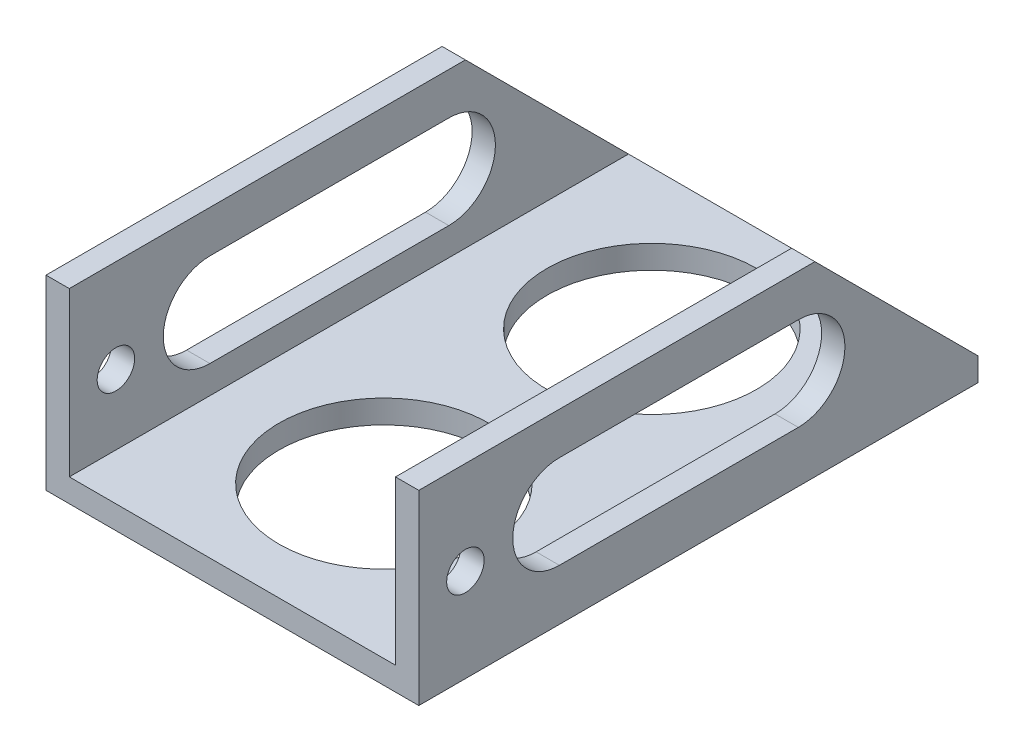
from build123d import *

# Parameters (mm, degrees)
BOSS_EXTRUDE1_DEPTH     = 76.2
CUT_EXTRUDE1_REACH      = 97.038
SKETCH2_R               = 14.2875
SKETCH3_R               = 2.5527
CUT_EXTRUDE2_DEPTH      = 96.038097624
CUT_EXTRUDE3_DEPTH      = 94.379551429
CUT_EXTRUDE3_DEPTH_BACK = 94.379551429
CUT_EXTRUDE4_REACH      = 96.239
SKETCH5_R               = 14.2875
CUT_EXTRUDE5_DEPTH      = 94.379551429
CUT_EXTRUDE5_DEPTH_BACK = 94.379551429


with BuildPart() as part:
    # Sketch1 → Boss-Extrude1 (new body)
    with BuildSketch(Plane.XY):
        Polygon((3.175, 3.175), (3.175, 25.4), (0, 25.4), (0, 0), (50.8, 0), (50.8, 25.4), (47.625, 25.4), (47.625, 3.175), align=None)
    extrude(amount=BOSS_EXTRUDE1_DEPTH)

    # Sketch2 → Cut-Extrude1 (cut, up to next)
    with BuildSketch(Plane.XZ, mode=Mode.PRIVATE) as cut_extrude1_sk1:
        with Locations((25.4, 19.05)):
            Circle(SKETCH2_R)
    cut_extrude1_tool1 = extrude(cut_extrude1_sk1.sketch, amount=-CUT_EXTRUDE1_REACH, mode=Mode.PRIVATE) & part.part
    add(cut_extrude1_tool1.solids().sort_by_distance((25.4, 0, 19.05))[0], mode=Mode.SUBTRACT)

    # Sketch3 → Cut-Extrude2 (cut, through all)
    with BuildSketch(Plane.ZY):
        with Locations((69.85, 12.7)):
            Circle(SKETCH3_R)
    extrude(amount=-CUT_EXTRUDE2_DEPTH, mode=Mode.SUBTRACT)

    # Sketch4 → Cut-Extrude3 (cut, two sides: drawn at the far end of the back side and taken through both)
    with BuildSketch(Plane.ZY.offset(-47.625).offset(-CUT_EXTRUDE3_DEPTH_BACK)):
        Polygon((0, 3.175), (22.225, 25.4), (0, 25.4), align=None)
    extrude(amount=CUT_EXTRUDE3_DEPTH + CUT_EXTRUDE3_DEPTH_BACK, mode=Mode.SUBTRACT)

    # Sketch5 → Cut-Extrude4 (cut, up to next)
    with BuildSketch(Plane(origin=(0, 3.175, 0), x_dir=(1, 0, 0), z_dir=(0, 1, 0)), mode=Mode.PRIVATE) as cut_extrude4_sk1:
        with Locations((25.4, -55.5625)):
            Circle(SKETCH5_R)
    cut_extrude4_tool1 = extrude(cut_extrude4_sk1.sketch, amount=-CUT_EXTRUDE4_REACH, mode=Mode.PRIVATE) & part.part
    add(cut_extrude4_tool1.solids().sort_by_distance((25.4, 3.175, 55.5625))[0], mode=Mode.SUBTRACT)

    # Sketch6 → Cut-Extrude5 (cut, two sides: drawn at the far end of the back side and taken through both)
    with BuildSketch(Plane.ZY.offset(-47.625).offset(-CUT_EXTRUDE5_DEPTH_BACK)):
        with BuildLine():
            Line((24.485892943, 19.673757433), (57.04010233, 19.673757433))
            ThreePointArc((57.04010233, 19.673757433), (63.39010233, 13.323757433), (57.04010233, 6.973757433))
            Line((57.04010233, 6.973757433), (24.485892943, 6.973757433))
            ThreePointArc((24.485892943, 6.973757433), (18.135892943, 13.323757433), (24.485892943, 19.673757433))
        make_face()
    extrude(amount=CUT_EXTRUDE5_DEPTH + CUT_EXTRUDE5_DEPTH_BACK, mode=Mode.SUBTRACT)


solid = part.part
